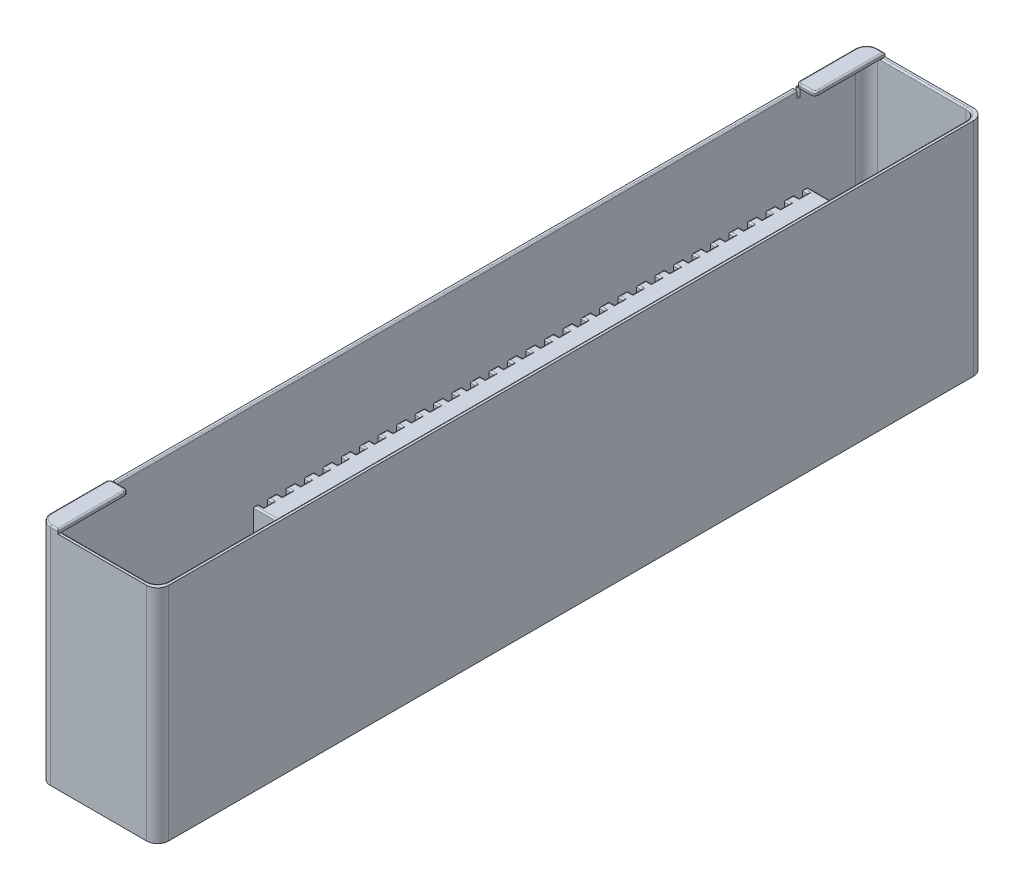
from build123d import *

# Parameters (mm, degrees)
SKETCH1_W           = 3.2
SKETCH1_H           = 22.4
SKETCH1_W_2         = 3
SKETCH1_H_2         = 22.2
BOSS_EXTRUDE1_DEPTH = 6
SKETCH2_W           = 3.2
SKETCH2_H           = 22.4
BOSS_EXTRUDE2_DEPTH = 0.1
BOSS_EXTRUDE4_DEPTH = 0.1
CUT_EXTRUDE1_DEPTH  = 0.2
BOSS_EXTRUDE5_DEPTH = 5.5
SKETCH6_W           = 0.15
SKETCH6_H           = 0.25
CUT_EXTRUDE2_DEPTH  = 5.5
SKETCH7_W           = 0.1
SKETCH7_H           = 0.2
BOSS_EXTRUDE6_DEPTH = 5.3
FILLET1_R           = 0.3
FILLET2_R           = 0.041
FILLET3_R           = 0.041
SKETCH8_W           = 0.35
SKETCH8_H           = 0.1
BOSS_EXTRUDE7_DEPTH = 5.5


with BuildPart() as part:
    # Sketch1 → Boss-Extrude1 (new body)
    with BuildSketch(Plane(origin=(0, 0, 0), x_dir=(1, 0, 0), z_dir=(0, 1, 0))):
        Rectangle(SKETCH1_W, SKETCH1_H)
        Rectangle(SKETCH1_W_2, SKETCH1_H_2, mode=Mode.SUBTRACT)
    extrude(amount=BOSS_EXTRUDE1_DEPTH)

    # Sketch2 → Boss-Extrude2 (add)
    with BuildSketch(Plane.XZ):
        Rectangle(SKETCH2_W, SKETCH2_H)
    extrude(amount=-BOSS_EXTRUDE2_DEPTH)

    # Sketch3 → Boss-Extrude4 (add)
    with BuildSketch(Plane(origin=(0, 6, 0), x_dir=(1, 0, 0), z_dir=(0, 1, 0))):
        with BuildLine():
            Line((-1.5, -9.3), (-1.2, -9.3))
            ThreePointArc((-1.2, -9.3), (-1.129289322, -9.329289322), (-1.1, -9.4))
            Line((-1.1, -9.4), (-1.1, -11.1))
            Line((-1.1, -11.1), (-1.1, -11.2))
            Line((-1.1, -11.2), (-1.6, -11.2))
            Line((-1.6, -11.2), (-1.6, -11.1))
            Line((-1.6, -11.1), (-1.6, -9.4))
            ThreePointArc((-1.6, -9.4), (-1.570710678, -9.329289322), (-1.5, -9.3))
        make_face()
    boss_extrude4 = extrude(amount=BOSS_EXTRUDE4_DEPTH)

    # Mirror1: Boss-Extrude4 across plane
    add(boss_extrude4.mirror(Plane.XY))

    # Sketch4 → Cut-Extrude1 (cut)
    with BuildSketch(Plane(origin=(0, 6, 0), x_dir=(1, 0, 0), z_dir=(0, 1, 0))):
        Polygon((-1.5, 9.3), (-1.2, 9.3), (-1.2, 9.21415935), (-1.772831952, 9.21415935), (-1.772831952, 9.3), align=None)
        Polygon((-1.2, -9.3), (-1.2, -9.21415935), (-1.772831952, -9.21415935), (-1.772831952, -9.3), (-1.5, -9.3), align=None)
    extrude(amount=-CUT_EXTRUDE1_DEPTH, mode=Mode.SUBTRACT)

    # Sketch5 → Boss-Extrude5 (add)
    with BuildSketch(Plane(origin=(0, 0.1, 0), x_dir=(1, 0, 0), z_dir=(0, 1, 0))):
        Polygon((0.5, 7.5), (0.5, -7.5), (1.3, -7.5), (1.3, 0), (1.3, 7.5), align=None)
    extrude(amount=BOSS_EXTRUDE5_DEPTH)

    # Sketch6 → Cut-Extrude2 (cut)
    with BuildSketch(Plane(origin=(0, 5.6, 0), x_dir=(1, 0, 0), z_dir=(0, 1, 0))):
        with Locations((0.575, 0.25)):
            Rectangle(SKETCH6_W, SKETCH6_H)
        with Locations((0.575, 0.75)):
            Rectangle(SKETCH6_W, SKETCH6_H)
        with Locations((0.575, 1.25)):
            Rectangle(SKETCH6_W, SKETCH6_H)
        with Locations((0.575, 1.75)):
            Rectangle(SKETCH6_W, SKETCH6_H)
        with Locations((0.575, 2.25)):
            Rectangle(SKETCH6_W, SKETCH6_H)
        with Locations((0.575, 2.75)):
            Rectangle(SKETCH6_W, SKETCH6_H)
        with Locations((0.575, 3.25)):
            Rectangle(SKETCH6_W, SKETCH6_H)
        with Locations((0.575, 3.75)):
            Rectangle(SKETCH6_W, SKETCH6_H)
        with Locations((0.575, 4.25)):
            Rectangle(SKETCH6_W, SKETCH6_H)
        with Locations((0.575, 4.75)):
            Rectangle(SKETCH6_W, SKETCH6_H)
        with Locations((0.575, 5.25)):
            Rectangle(SKETCH6_W, SKETCH6_H)
        with Locations((0.575, 5.75)):
            Rectangle(SKETCH6_W, SKETCH6_H)
        with Locations((0.575, 6.25)):
            Rectangle(SKETCH6_W, SKETCH6_H)
        with Locations((0.575, 6.75)):
            Rectangle(SKETCH6_W, SKETCH6_H)
        with Locations((0.575, 7.25)):
            Rectangle(SKETCH6_W, SKETCH6_H)
        with Locations((0.575, -7.25)):
            Rectangle(SKETCH6_W, SKETCH6_H)
        with Locations((0.575, -6.75)):
            Rectangle(SKETCH6_W, SKETCH6_H)
        with Locations((0.575, -6.25)):
            Rectangle(SKETCH6_W, SKETCH6_H)
        with Locations((0.575, -5.75)):
            Rectangle(SKETCH6_W, SKETCH6_H)
        with Locations((0.575, -5.25)):
            Rectangle(SKETCH6_W, SKETCH6_H)
        with Locations((0.575, -4.75)):
            Rectangle(SKETCH6_W, SKETCH6_H)
        with Locations((0.575, -4.25)):
            Rectangle(SKETCH6_W, SKETCH6_H)
        with Locations((0.575, -3.75)):
            Rectangle(SKETCH6_W, SKETCH6_H)
        with Locations((0.575, -3.25)):
            Rectangle(SKETCH6_W, SKETCH6_H)
        with Locations((0.575, -2.75)):
            Rectangle(SKETCH6_W, SKETCH6_H)
        with Locations((0.575, -2.25)):
            Rectangle(SKETCH6_W, SKETCH6_H)
        with Locations((0.575, -1.75)):
            Rectangle(SKETCH6_W, SKETCH6_H)
        with Locations((0.575, -1.25)):
            Rectangle(SKETCH6_W, SKETCH6_H)
        with Locations((0.575, -0.75)):
            Rectangle(SKETCH6_W, SKETCH6_H)
        with Locations((0.575, -0.25)):
            Rectangle(SKETCH6_W, SKETCH6_H)
    extrude(amount=-CUT_EXTRUDE2_DEPTH, mode=Mode.SUBTRACT)

    # Sketch7 → Boss-Extrude6 (add)
    with BuildSketch(Plane(origin=(0, 0.1, 0), x_dir=(1, 0, 0), z_dir=(0, 1, 0))):
        with Locations((0.575, -7.25)):
            Rectangle(SKETCH7_W, SKETCH7_H)
        with Locations((0.575, -6.75)):
            Rectangle(SKETCH7_W, SKETCH7_H)
        with Locations((0.575, -6.25)):
            Rectangle(SKETCH7_W, SKETCH7_H)
        with Locations((0.575, -5.75)):
            Rectangle(SKETCH7_W, SKETCH7_H)
        with Locations((0.575, -5.25)):
            Rectangle(SKETCH7_W, SKETCH7_H)
        with Locations((0.575, -4.75)):
            Rectangle(SKETCH7_W, SKETCH7_H)
        with Locations((0.575, -4.25)):
            Rectangle(SKETCH7_W, SKETCH7_H)
        with Locations((0.575, -3.75)):
            Rectangle(SKETCH7_W, SKETCH7_H)
        with Locations((0.575, -3.25)):
            Rectangle(SKETCH7_W, SKETCH7_H)
        with Locations((0.575, -2.75)):
            Rectangle(SKETCH7_W, SKETCH7_H)
        with Locations((0.575, -2.25)):
            Rectangle(SKETCH7_W, SKETCH7_H)
        with Locations((0.575, -1.75)):
            Rectangle(SKETCH7_W, SKETCH7_H)
        with Locations((0.575, -1.25)):
            Rectangle(SKETCH7_W, SKETCH7_H)
        with Locations((0.575, -0.75)):
            Rectangle(SKETCH7_W, SKETCH7_H)
        with Locations((0.575, -0.25)):
            Rectangle(SKETCH7_W, SKETCH7_H)
        with Locations((0.575, 0.25)):
            Rectangle(SKETCH7_W, SKETCH7_H)
        with Locations((0.575, 0.75)):
            Rectangle(SKETCH7_W, SKETCH7_H)
        with Locations((0.575, 1.25)):
            Rectangle(SKETCH7_W, SKETCH7_H)
        with Locations((0.575, 1.75)):
            Rectangle(SKETCH7_W, SKETCH7_H)
        with Locations((0.575, 2.25)):
            Rectangle(SKETCH7_W, SKETCH7_H)
        with Locations((0.575, 2.75)):
            Rectangle(SKETCH7_W, SKETCH7_H)
        with Locations((0.575, 3.25)):
            Rectangle(SKETCH7_W, SKETCH7_H)
        with Locations((0.575, 3.75)):
            Rectangle(SKETCH7_W, SKETCH7_H)
        with Locations((0.575, 4.25)):
            Rectangle(SKETCH7_W, SKETCH7_H)
        with Locations((0.575, 4.75)):
            Rectangle(SKETCH7_W, SKETCH7_H)
        with Locations((0.575, 5.25)):
            Rectangle(SKETCH7_W, SKETCH7_H)
        with Locations((0.575, 5.75)):
            Rectangle(SKETCH7_W, SKETCH7_H)
        with Locations((0.575, 6.25)):
            Rectangle(SKETCH7_W, SKETCH7_H)
        with Locations((0.575, 6.75)):
            Rectangle(SKETCH7_W, SKETCH7_H)
        with Locations((0.575, 7.25)):
            Rectangle(SKETCH7_W, SKETCH7_H)
    extrude(amount=BOSS_EXTRUDE6_DEPTH)

    # Fillet1
    fillet1_edges = [part.edges().sort_by_distance(p)[0] for p in [
        (1.6, 3, 11.2),
        (-1.6, 3.05, 11.2),
        (-1.6, 3.05, -11.2),
        (1.6, 3, -11.2),
        (-1.5, 3.05, 11.1),
        (1.5, 3.05, 11.1),
        (1.5, 3.05, -11.1),
        (-1.5, 3.05, -11.1),
    ]]
    fillet(fillet1_edges, radius=FILLET1_R)

    # Fillet2
    fillet2_edges = [part.edges().sort_by_distance(p)[0] for p in [
        (1.3, 5.6, 0),
        (0.5, 5.6, -7.4375),
        (0.9, 5.6, 7.5),
        (0.9, 5.6, -7.5),
        (0.5, 5.6, 7.4375),
        (0.575, 5.6, 7.375),
        (0.65, 5.6, 7.25),
        (0.575, 5.6, 7.125),
        (0.5, 5.6, -7),
        (0.5, 5.6, -6.5),
        (0.5, 5.6, -6),
        (0.5, 5.6, -5.5),
        (0.5, 5.6, -5),
        (0.5, 5.6, -4.5),
        (0.5, 5.6, -4),
        (0.5, 5.6, -3.5),
        (0.5, 5.6, -3),
        (0.5, 5.6, -2.5),
        (0.5, 5.6, -2),
        (0.5, 5.6, -1.5),
        (0.5, 5.6, -1),
        (0.5, 5.6, -0.5),
        (0.5, 5.6, 0),
        (0.5, 5.6, 0.5),
        (0.5, 5.6, 1),
        (0.5, 5.6, 1.5),
        (0.5, 5.6, 2),
        (0.5, 5.6, 2.5),
        (0.5, 5.6, 3),
        (0.5, 5.6, 3.5),
        (0.5, 5.6, 4),
        (0.5, 5.6, 4.5),
        (0.5, 5.6, 5),
        (0.5, 5.6, 5.5),
        (0.5, 5.6, 6),
        (0.5, 5.6, 6.5),
        (0.5, 5.6, 7),
        (0.575, 5.6, 4.875),
        (0.65, 5.6, 4.75),
        (0.575, 5.6, 4.625),
        (0.575, 5.6, 5.375),
        (0.65, 5.6, 5.25),
        (0.575, 5.6, 5.125),
        (0.575, 5.6, 5.875),
        (0.65, 5.6, 5.75),
        (0.575, 5.6, 5.625),
        (0.575, 5.6, 6.375),
        (0.65, 5.6, 6.25),
        (0.575, 5.6, 6.125),
        (0.575, 5.6, -6.625),
        (0.65, 5.6, -6.75),
        (0.575, 5.6, -6.875),
        (0.575, 5.6, -7.125),
        (0.65, 5.6, -7.25),
        (0.575, 5.6, -7.375),
        (0.575, 5.6, 6.875),
        (0.65, 5.6, 6.75),
        (0.575, 5.6, 6.625),
        (0.575, 5.6, 4.375),
        (0.65, 5.6, 4.25),
        (0.575, 5.6, 4.125),
        (0.575, 5.6, 3.875),
        (0.65, 5.6, 3.75),
        (0.575, 5.6, 3.625),
        (0.575, 5.6, 3.375),
        (0.65, 5.6, 3.25),
        (0.575, 5.6, 3.125),
        (0.575, 5.6, 2.875),
        (0.65, 5.6, 2.75),
        (0.575, 5.6, 2.625),
        (0.575, 5.6, 2.375),
        (0.65, 5.6, 2.25),
        (0.575, 5.6, 2.125),
        (0.575, 5.6, 1.875),
        (0.65, 5.6, 1.75),
        (0.575, 5.6, 1.625),
        (0.575, 5.6, 1.375),
        (0.65, 5.6, 1.25),
        (0.575, 5.6, 1.125),
        (0.575, 5.6, 0.875),
        (0.65, 5.6, 0.75),
        (0.575, 5.6, 0.625),
        (0.575, 5.6, -6.125),
        (0.65, 5.6, -6.25),
        (0.575, 5.6, -6.375),
        (0.575, 5.6, -5.625),
        (0.65, 5.6, -5.75),
        (0.575, 5.6, -5.875),
        (0.575, 5.6, -5.125),
        (0.65, 5.6, -5.25),
        (0.575, 5.6, -5.375),
        (0.575, 5.6, -4.625),
        (0.65, 5.6, -4.75),
        (0.575, 5.6, -4.875),
        (0.575, 5.6, -4.125),
        (0.65, 5.6, -4.25),
        (0.575, 5.6, -4.375),
        (0.575, 5.6, -3.625),
        (0.65, 5.6, -3.75),
        (0.575, 5.6, -3.875),
        (0.575, 5.6, -3.125),
        (0.65, 5.6, -3.25),
        (0.575, 5.6, -3.375),
        (0.575, 5.6, -2.625),
        (0.65, 5.6, -2.75),
        (0.575, 5.6, -2.875),
        (0.575, 5.6, -2.125),
        (0.65, 5.6, -2.25),
        (0.575, 5.6, -2.375),
        (0.575, 5.6, -1.625),
        (0.65, 5.6, -1.75),
        (0.575, 5.6, -1.875),
        (0.575, 5.6, -1.125),
        (0.65, 5.6, -1.25),
        (0.575, 5.6, -1.375),
        (0.575, 5.6, -0.625),
        (0.65, 5.6, -0.75),
        (0.575, 5.6, -0.875),
        (0.575, 5.6, -0.125),
        (0.65, 5.6, -0.25),
        (0.575, 5.6, -0.375),
        (0.575, 5.6, 0.125),
        (0.575, 5.6, 0.375),
        (0.65, 5.6, 0.25),
    ]]
    fillet(fillet2_edges, radius=FILLET2_R)

    # Fillet3
    fillet3_edges = [part.edges().sort_by_distance(p)[0] for p in [
        (0.05, 6, 11.1),
        (-1.570710678, 6.1, 9.329289322),
        (-1.6, 6.1, 10.15),
        (-1.1, 6.1, 10.3),
        (-1.129289322, 6.1, 9.329289322),
        (-1.35, 6.1, 9.3),
        (0.05, 6, -11.1),
        (-1.570710678, 6.1, -9.329289322),
        (-1.35, 6.1, -9.3),
        (-1.129289322, 6.1, -9.329289322),
        (-1.1, 6.1, -10.3),
        (-1.6, 6.1, -10.15),
        (-1.5, 6, 0),
        (1.5, 6, 0),
        (-1.2, 6.1, -11.2),
        (-1.512132034, 6.1, -11.112132034),
        (-1.2, 6.1, 11.2),
        (-1.512132034, 6.1, 11.112132034),
        (1.412132034, 6, 11.012132034),
        (1.412132034, 6, -11.012132034),
    ]]
    fillet(fillet3_edges, radius=FILLET3_R)

    # Sketch8 → Boss-Extrude7 (add)
    with BuildSketch(Plane(origin=(0, 0.1, 0), x_dir=(1, 0, 0), z_dir=(0, 1, 0))):
        with Locations((1.325, 8.35)):
            Rectangle(SKETCH8_W, SKETCH8_H)
        with Locations((1.325, -8.35)):
            Rectangle(SKETCH8_W, SKETCH8_H)
    extrude(amount=BOSS_EXTRUDE7_DEPTH)


solid = part.part
